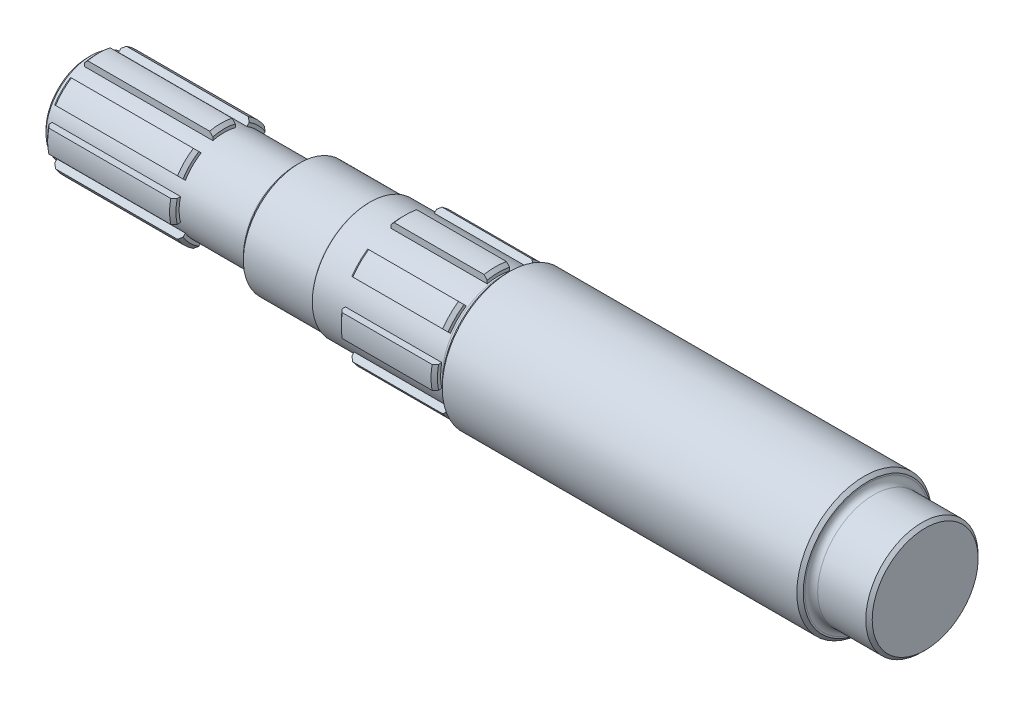
from build123d import *
from build123d.topology import SkipClean

# Parameters (mm, degrees)
SKETCH2_R           = 14
BOSS_EXTRUDE1_DEPTH = 65
CUT_EXTRUDE1_START  = -30
CUT_EXTRUDE1_DEPTH  = 30
FILLET1_R           = 2
FILLET2_R           = 2
FILLET3_R           = 0.5
CHAMFER1_SIZE       = 1
BOSS_EXTRUDE4_START = -40
BOSS_EXTRUDE4_DEPTH = 40
CHAMFER3_SIZE       = 1
CHAMFER4_SIZE       = 1
FILLET4_R           = 2
CHAMFER5_SIZE       = 1
CHAMFER7_SIZE       = 1
CHAMFER8_SIZE       = 1


# Some blends are built 0.0001 mm under size
with BuildPart() as part:
    # Sketch1 → Revolve1 (revolve)
    with BuildSketch(Plane.XY, mode=Mode.PRIVATE) as revolve1_sk:
        Polygon((-80.515695067, 0), (-80.515695067, 17.5), (-57.515695067, 17.5), (-57.515695067, 18), (-47.515695067, 18), (-47.515695067, 20), (-17.515695067, 20), (-17.515695067, 18), (-15.015695067, 18), (-15.015695067, 21), (97.484304933, 21), (97.484304933, 17.5), (115.484304933, 17.5), (115.484304933, 0), align=None)
    revolve(revolve1_sk.sketch.rotate(Axis((-88.520179372, 0, 0), (1, 0, 0)), 90), axis=Axis((-88.520179372, 0, 0), (1, 0, 0)))

    # Sketch2 → Boss-Extrude1 (add)
    with BuildSketch(Plane.ZY.offset(80.515695067)):
        Circle(SKETCH2_R)
    extrude(amount=BOSS_EXTRUDE1_DEPTH)

    # Sketch3 → Cut-Extrude1 (cut)
    with SkipClean():  # the faces are left unmerged after this step: merging them gives an invalid solid
        with BuildSketch(Plane.ZY.offset(47.515695067).offset(CUT_EXTRUDE1_START)):
            with BuildLine():
                Line((3.5, 19.691368668), (3.5, 17.656443583))
                ThreePointArc((3.5, 17.656443583), (6.888301783, 16.629831585), (10.010117255, 14.959864723))
                Line((10.010117255, 14.959864723), (11.449026581, 16.39877405))
                ThreePointArc((11.449026581, 16.39877405), (7.653668647, 18.47759065), (3.5, 19.691368668))
            make_face()
            with BuildLine():
                Line((-3.5, 19.691368668), (-3.5, 17.656443583))
                ThreePointArc((-3.5, 17.656443583), (-6.888301783, 16.629831585), (-10.010117255, 14.959864723))
                Line((-10.010117255, 14.959864723), (-11.449026581, 16.39877405))
                ThreePointArc((-11.449026581, 16.39877405), (-7.653668647, 18.47759065), (-3.5, 19.691368668))
            make_face()
            with BuildLine():
                Line((16.39877405, 11.449026581), (14.959864723, 10.010117255))
                ThreePointArc((14.959864723, 10.010117255), (16.629831585, 6.888301783), (17.656443583, 3.5))
                Line((17.656443583, 3.5), (19.691368668, 3.5))
                ThreePointArc((19.691368668, 3.5), (18.47759065, 7.653668647), (16.39877405, 11.449026581))
            make_face()
            with BuildLine():
                Line((19.691368668, -3.5), (17.656443583, -3.5))
                ThreePointArc((17.656443583, -3.5), (16.629831585, -6.888301783), (14.959864723, -10.010117255))
                Line((14.959864723, -10.010117255), (16.39877405, -11.449026581))
                ThreePointArc((16.39877405, -11.449026581), (18.47759065, -7.653668647), (19.691368668, -3.5))
            make_face()
            with BuildLine():
                Line((11.449026581, -16.39877405), (10.010117255, -14.959864723))
                ThreePointArc((10.010117255, -14.959864723), (6.888301783, -16.629831585), (3.5, -17.656443583))
                Line((3.5, -17.656443583), (3.5, -19.691368668))
                ThreePointArc((3.5, -19.691368668), (7.653668647, -18.47759065), (11.449026581, -16.39877405))
            make_face()
            with BuildLine():
                Line((-3.5, -19.691368668), (-3.5, -17.656443583))
                ThreePointArc((-3.5, -17.656443583), (-6.888301783, -16.629831585), (-10.010117255, -14.959864723))
                Line((-10.010117255, -14.959864723), (-11.449026581, -16.39877405))
                ThreePointArc((-11.449026581, -16.39877405), (-7.653668647, -18.47759065), (-3.5, -19.691368668))
            make_face()
            with BuildLine():
                Line((-16.39877405, -11.449026581), (-14.959864723, -10.010117255))
                ThreePointArc((-14.959864723, -10.010117255), (-16.629831585, -6.888301783), (-17.656443583, -3.5))
                Line((-17.656443583, -3.5), (-19.691368668, -3.5))
                ThreePointArc((-19.691368668, -3.5), (-18.47759065, -7.653668647), (-16.39877405, -11.449026581))
            make_face()
            with BuildLine():
                Line((-19.691368668, 3.5), (-17.656443583, 3.5))
                ThreePointArc((-17.656443583, 3.5), (-16.629831585, 6.888301783), (-14.959864723, 10.010117255))
                Line((-14.959864723, 10.010117255), (-16.39877405, 11.449026581))
                ThreePointArc((-16.39877405, 11.449026581), (-18.47759065, 7.653668647), (-19.691368668, 3.5))
            make_face()
        extrude(amount=CUT_EXTRUDE1_DEPTH, mode=Mode.SUBTRACT)

    # Fillet1
    fillet1_edges = [part.edges().sort_by_distance(p)[0] for p in [
        (-15.015695067, 0, -18),
    ]]
    fillet(fillet1_edges, radius=FILLET1_R)

    # Fillet2
    fillet2_edges = [part.edges().sort_by_distance(p)[0] for p in [
        (97.484304933, 0, -17.5),
    ]]
    fillet(fillet2_edges, radius=FILLET2_R)

    # Fillet3
    fillet3_edges = [part.edges().sort_by_distance(p)[0] for p in [
        (-57.515695067, 0, -17.5),
    ]]
    fillet(fillet3_edges, radius=FILLET3_R - 0.0001)  # a hair under: the kernel refuses the full size

    # Chamfer1
    # the kernel refuses this chamfer: 1 mm, written as the material it adds along each edge
    with BuildSketch(Plane(origin=(-47.515695067, 0, 0), x_dir=(0, -0.9018204350673957, -0.43211098446446955), z_dir=(0, -0.43211098446446955, 0.9018204350673957))) as chamfer1_piece_1_section:
        Polygon((18, -CHAMFER1_SIZE), (18 + CHAMFER1_SIZE, 0), (18, 0), align=None)
    chamfer1_piece_1 = revolve(axis=Axis((-47.515695067, 0, 0), (1, 0, 0)), revolution_arc=38.796793403, mode=Mode.PRIVATE)
    chamfer1_piece_1 = split(chamfer1_piece_1, bisect_by=Plane(origin=(-47.84551159, -15.3563585, -10.406611032), z_dir=(0, 0.7071067811865462, -0.7071067811865489)), keep=Keep.TOP, mode=Mode.PRIVATE)
    chamfer1_piece_1 = split(chamfer1_piece_1, bisect_by=Plane(origin=(-47.84551159, -10.406611032, -15.3563585), z_dir=(0, -0.7071067811865492, 0.7071067811865458)), keep=Keep.TOP, mode=Mode.PRIVATE)
    add(chamfer1_piece_1)
    # the kernel refuses this chamfer: 1 mm, written as the material it takes off along each edge
    with BuildSketch(Plane(origin=(-17.515695067, 0, 0), x_dir=(0, 0.8865763462424374, 0.46258229784916083), z_dir=(0, 0.46258229784916083, -0.8865763462424374))) as chamfer1_2_piece_1:
        Polygon((20, -CHAMFER1_SIZE), (20 - CHAMFER1_SIZE, 0), (20, 0), align=None)
    revolve(axis=Axis((-17.515695067, 0, 0), (1, 0, 0)), revolution_arc=34.892271196, mode=Mode.SUBTRACT)
    with BuildSketch(Plane(origin=(-17.515695067, 0, 0), x_dir=(0, 0.9539992261336169, -0.29980906680162295), z_dir=(0, -0.29980906680162295, -0.9539992261336169))) as chamfer1_2_piece_2:
        Polygon((20, -CHAMFER1_SIZE), (20 - CHAMFER1_SIZE, 0), (20, 0), align=None)
    revolve(axis=Axis((-17.515695067, 0, 0), (1, 0, 0)), revolution_arc=34.892271196, mode=Mode.SUBTRACT)
    with BuildSketch(Plane(origin=(-17.515695067, 0, 0), x_dir=(0, 0.46258229784916044, -0.8865763462424375), z_dir=(0, -0.8865763462424375, -0.46258229784916044))) as chamfer1_2_piece_3:
        Polygon((20, -CHAMFER1_SIZE), (20 - CHAMFER1_SIZE, 0), (20, 0), align=None)
    revolve(axis=Axis((-17.515695067, 0, 0), (1, 0, 0)), revolution_arc=34.892271196, mode=Mode.SUBTRACT)
    with BuildSketch(Plane(origin=(-17.515695067, 0, 0), x_dir=(0, -0.2998090668016235, -0.9539992261336169), z_dir=(0, -0.9539992261336169, 0.2998090668016235))) as chamfer1_2_piece_4:
        Polygon((20, -CHAMFER1_SIZE), (20 - CHAMFER1_SIZE, 0), (20, 0), align=None)
    revolve(axis=Axis((-17.515695067, 0, 0), (1, 0, 0)), revolution_arc=34.892271196, mode=Mode.SUBTRACT)
    with BuildSketch(Plane(origin=(-17.515695067, 0, 0), x_dir=(0, -0.8865763462424375, -0.46258229784916055), z_dir=(0, -0.46258229784916055, 0.8865763462424375))) as chamfer1_2_piece_5:
        Polygon((20 - CHAMFER1_SIZE, 0), (20, -CHAMFER1_SIZE), (20, 0), align=None)
    revolve(axis=Axis((-17.515695067, 0, 0), (1, 0, 0)), revolution_arc=34.892271196, mode=Mode.SUBTRACT)
    with BuildSketch(Plane(origin=(-17.515695067, 0, 0), x_dir=(0, -0.953999226133617, 0.29980906680162295), z_dir=(0, 0.29980906680162295, 0.953999226133617))) as chamfer1_2_piece_6:
        Polygon((20, -CHAMFER1_SIZE), (20 - CHAMFER1_SIZE, 0), (20, 0), align=None)
    revolve(axis=Axis((-17.515695067, 0, 0), (1, 0, 0)), revolution_arc=34.892271196, mode=Mode.SUBTRACT)
    with BuildSketch(Plane(origin=(-17.515695067, 0, 0), x_dir=(0, -0.46258229784916055, 0.8865763462424375), z_dir=(0, 0.8865763462424375, 0.46258229784916055))) as chamfer1_2_piece_7:
        Polygon((20, -CHAMFER1_SIZE), (20 - CHAMFER1_SIZE, 0), (20, 0), align=None)
    revolve(axis=Axis((-17.515695067, 0, 0), (1, 0, 0)), revolution_arc=34.892271196, mode=Mode.SUBTRACT)
    with BuildSketch(Plane(origin=(-17.515695067, 0, 0), x_dir=(0, 0.2998072133832852, 0.9539998085971242), z_dir=(0, 0.9539998085971242, -0.2998072133832852))) as chamfer1_2_piece_8:
        Polygon((20, -CHAMFER1_SIZE), (20 - CHAMFER1_SIZE, 0), (20, 0), align=None)
    revolve(axis=Axis((-17.515695067, 0, 0), (1, 0, 0)), revolution_arc=17.446024285, mode=Mode.SUBTRACT)
    with BuildSketch(Plane(origin=(-47.515695067, 0, 0), x_dir=(0, 0.8865763462424378, 0.46258229784916), z_dir=(0, 0.46258229784916, -0.8865763462424378))) as chamfer1_2_piece_9:
        Polygon((20 - CHAMFER1_SIZE, 0), (20, CHAMFER1_SIZE), (20, 0), align=None)
    revolve(axis=Axis((-47.515695067, 0, 0), (1, 0, 0)), revolution_arc=34.892271196, mode=Mode.SUBTRACT)
    with BuildSketch(Plane(origin=(-47.515695067, 0, 0), x_dir=(0, 0.9539992261336167, -0.2998090668016239), z_dir=(0, -0.2998090668016239, -0.9539992261336167))) as chamfer1_2_piece_10:
        Polygon((20 - CHAMFER1_SIZE, 0), (20, CHAMFER1_SIZE), (20, 0), align=None)
    revolve(axis=Axis((-47.515695067, 0, 0), (1, 0, 0)), revolution_arc=34.892271196, mode=Mode.SUBTRACT)
    with BuildSketch(Plane(origin=(-47.515695067, 0, 0), x_dir=(0, 0.4625822978491601, -0.8865763462424378), z_dir=(0, -0.8865763462424378, -0.4625822978491601))) as chamfer1_2_piece_11:
        Polygon((20 - CHAMFER1_SIZE, 0), (20, CHAMFER1_SIZE), (20, 0), align=None)
    revolve(axis=Axis((-47.515695067, 0, 0), (1, 0, 0)), revolution_arc=34.892271196, mode=Mode.SUBTRACT)
    with BuildSketch(Plane(origin=(-47.515695067, 0, 0), x_dir=(0, -0.2998090668016239, -0.9539992261336167), z_dir=(0, -0.9539992261336167, 0.2998090668016239))) as chamfer1_2_piece_12:
        Polygon((20 - CHAMFER1_SIZE, 0), (20, CHAMFER1_SIZE), (20, 0), align=None)
    revolve(axis=Axis((-47.515695067, 0, 0), (1, 0, 0)), revolution_arc=34.892271196, mode=Mode.SUBTRACT)
    with BuildSketch(Plane(origin=(-47.515695067, 0, 0), x_dir=(0, -0.9539992261336169, 0.2998090668016234), z_dir=(0, 0.2998090668016234, 0.9539992261336169))) as chamfer1_2_piece_13:
        Polygon((20 - CHAMFER1_SIZE, 0), (20, CHAMFER1_SIZE), (20, 0), align=None)
    revolve(axis=Axis((-47.515695067, 0, 0), (1, 0, 0)), revolution_arc=34.892271196, mode=Mode.SUBTRACT)
    with BuildSketch(Plane(origin=(-47.515695067, 0, 0), x_dir=(0, -0.46258229784916033, 0.8865763462424378), z_dir=(0, 0.8865763462424378, 0.46258229784916033))) as chamfer1_2_piece_14:
        Polygon((20 - CHAMFER1_SIZE, 0), (20, CHAMFER1_SIZE), (20, 0), align=None)
    revolve(axis=Axis((-47.515695067, 0, 0), (1, 0, 0)), revolution_arc=34.892271196, mode=Mode.SUBTRACT)
    with BuildSketch(Plane(origin=(-47.515695067, 0, 0), x_dir=(0, 0.2998072133832852, 0.9539998085971242), z_dir=(0, 0.9539998085971242, -0.2998072133832852))) as chamfer1_2_piece_15:
        Polygon((20 - CHAMFER1_SIZE, 0), (20, CHAMFER1_SIZE), (20, 0), align=None)
    revolve(axis=Axis((-47.515695067, 0, 0), (1, 0, 0)), revolution_arc=17.446024285, mode=Mode.SUBTRACT)
    with BuildSketch(Plane(origin=(-47.515695067, 0, 0), x_dir=(0, 0, 1), z_dir=(0, 1, 0))) as chamfer1_2_piece_16:
        Polygon((20 - CHAMFER1_SIZE, 0), (20, CHAMFER1_SIZE), (20, 0), align=None)
    revolve(axis=Axis((-47.515695067, 0, 0), (1, 0, 0)), revolution_arc=17.446024285, mode=Mode.SUBTRACT)
    with BuildSketch(Plane(origin=(-17.515695067, 0, 0), x_dir=(0, 0, 1), z_dir=(0, 1, 0))) as chamfer1_2_piece_17:
        Polygon((20, -CHAMFER1_SIZE), (20 - CHAMFER1_SIZE, 0), (20, 0), align=None)
    revolve(axis=Axis((-17.515695067, 0, 0), (1, 0, 0)), revolution_arc=17.446024285, mode=Mode.SUBTRACT)

    # Sketch6 → Boss-Extrude4 (add)
    with BuildSketch(Plane.ZY.offset(143.015695067).offset(BOSS_EXTRUDE4_START)):
        with BuildLine():
            Line((-3.5, 15.612494996), (-3.5, 13.555441712))
            ThreePointArc((-3.5, 13.555441712), (0, 14), (3.5, 13.555441712))
            Line((3.5, 13.555441712), (3.5, 15.612494996))
            ThreePointArc((3.5, 15.612494996), (0, 16), (-3.5, 15.612494996))
        make_face()
        with BuildLine():
            Line((13.514574817, 8.564827349), (12.06001849, 7.110271022))
            ThreePointArc((12.06001849, 7.110271022), (9.899494937, 9.899494937), (7.110271022, 12.06001849))
            Line((7.110271022, 12.06001849), (8.564827349, 13.514574817))
            ThreePointArc((8.564827349, 13.514574817), (11.313708499, 11.313708499), (13.514574817, 8.564827349))
        make_face()
        with BuildLine():
            Line((15.612494996, -3.5), (13.555441712, -3.5))
            ThreePointArc((13.555441712, -3.5), (14, 0), (13.555441712, 3.5))
            Line((13.555441712, 3.5), (15.612494996, 3.5))
            ThreePointArc((15.612494996, 3.5), (16, 0), (15.612494996, -3.5))
        make_face()
        with BuildLine():
            Line((8.564827349, -13.514574817), (7.110271022, -12.06001849))
            ThreePointArc((7.110271022, -12.06001849), (9.899494937, -9.899494937), (12.06001849, -7.110271022))
            Line((12.06001849, -7.110271022), (13.514574817, -8.564827349))
            ThreePointArc((13.514574817, -8.564827349), (11.313708499, -11.313708499), (8.564827349, -13.514574817))
        make_face()
        with BuildLine():
            Line((-3.5, -15.612494996), (-3.5, -13.555441712))
            ThreePointArc((-3.5, -13.555441712), (0, -14), (3.5, -13.555441712))
            Line((3.5, -13.555441712), (3.5, -15.612494996))
            ThreePointArc((3.5, -15.612494996), (0, -16), (-3.5, -15.612494996))
        make_face()
        with BuildLine():
            Line((-13.514574817, -8.564827349), (-12.06001849, -7.110271022))
            ThreePointArc((-12.06001849, -7.110271022), (-9.899494937, -9.899494937), (-7.110271022, -12.06001849))
            Line((-7.110271022, -12.06001849), (-8.564827349, -13.514574817))
            ThreePointArc((-8.564827349, -13.514574817), (-11.313708499, -11.313708499), (-13.514574817, -8.564827349))
        make_face()
        with BuildLine():
            Line((-15.612494996, 3.5), (-13.555441712, 3.5))
            ThreePointArc((-13.555441712, 3.5), (-14, 0), (-13.555441712, -3.5))
            Line((-13.555441712, -3.5), (-15.612494996, -3.5))
            ThreePointArc((-15.612494996, -3.5), (-16, 0), (-15.612494996, 3.5))
        make_face()
        with BuildLine():
            Line((-8.564827349, 13.514574817), (-7.110271022, 12.06001849))
            ThreePointArc((-7.110271022, 12.06001849), (-9.899494937, 9.899494937), (-12.06001849, 7.110271022))
            Line((-12.06001849, 7.110271022), (-13.514574817, 8.564827349))
            ThreePointArc((-13.514574817, 8.564827349), (-11.313708499, 11.313708499), (-8.564827349, 13.514574817))
        make_face()
    extrude(amount=BOSS_EXTRUDE4_DEPTH)

    # Chamfer3
    chamfer3_edges = [part.edges().sort_by_distance(p)[0] for p in [
        (-103.015695067, 16, 0),
        (-143.015695067, 16, 0),
        (-103.015695067, 11.313708499, 11.313708499),
        (-143.015695067, 11.313708499, 11.313708499),
        (-103.015695067, 0, 16),
        (-143.015695067, 0, 16),
        (-145.515695067, 0, -14),
        (-103.015695067, -11.313708499, 11.313708499),
        (-143.015695067, -11.313708499, 11.313708499),
        (-103.015695067, -16, 0),
        (-143.015695067, -16, 0),
        (-103.015695067, -11.313708499, -11.313708499),
        (-143.015695067, -11.313708499, -11.313708499),
        (-103.015695067, 0, -16),
        (-143.015695067, 0, -16),
        (-103.015695067, 11.313708499, -11.313708499),
        (-143.015695067, 11.313708499, -11.313708499),
    ]]
    chamfer(chamfer3_edges, length=CHAMFER3_SIZE)

    # Chamfer4
    chamfer4_edges = [part.edges().sort_by_distance(p)[0] for p in [
        (-80.515695067, 0, -17.5),
    ]]
    chamfer(chamfer4_edges, length=CHAMFER4_SIZE)

    # Fillet4
    fillet4_edges = [part.edges().sort_by_distance(p)[0] for p in [
        (-80.515695067, 0, -14),
    ]]
    fillet(fillet4_edges, radius=FILLET4_R)

    # Chamfer5
    chamfer5_edges = [part.edges().sort_by_distance(p)[0] for p in [
        (-15.015695067, 0, -21),
    ]]
    chamfer(chamfer5_edges, length=CHAMFER5_SIZE - 0.0001)  # a hair under: the kernel refuses the full size

    # Chamfer7
    chamfer7_edges = [part.edges().sort_by_distance(p)[0] for p in [
        (97.484304933, 0, -21),
    ]]
    chamfer(chamfer7_edges, length=CHAMFER7_SIZE)

    # Chamfer8
    chamfer8_edges = [part.edges().sort_by_distance(p)[0] for p in [
        (115.484304933, 0, -17.5),
    ]]
    chamfer(chamfer8_edges, length=CHAMFER8_SIZE)


solid = part.part
